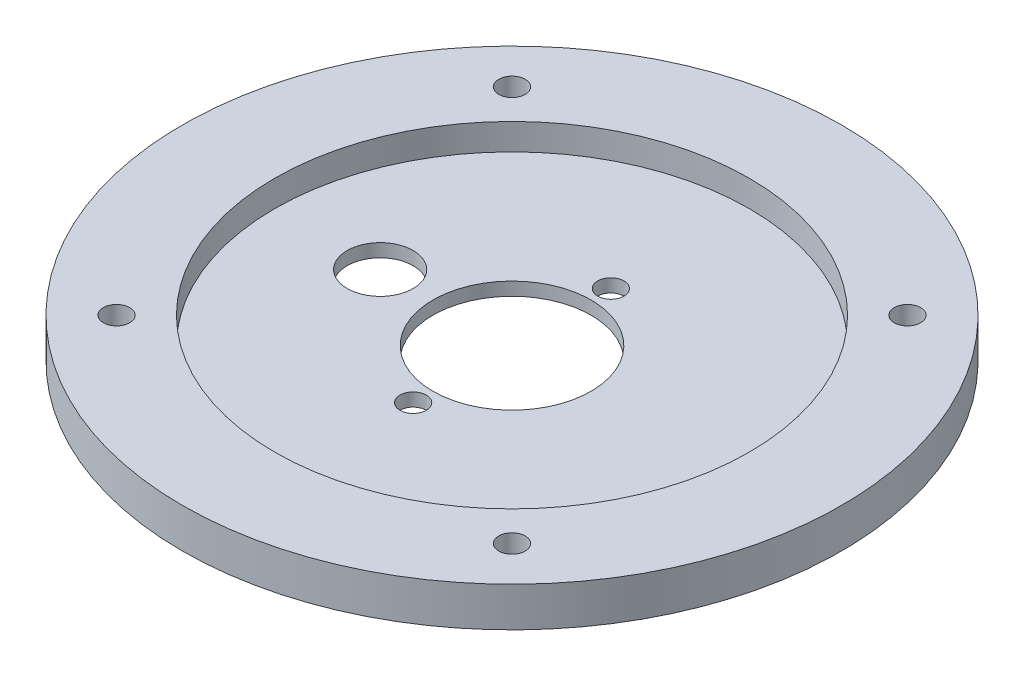
from build123d import *

# Parameters (mm, degrees)
SKETCH1_R           = 25
BOSS_EXTRUDE1_DEPTH = 3
SKETCH3_R           = 6
SKETCH3_R_2         = 1
CUT_EXTRUDE1_DEPTH  = 36.482389998
SKETCH4_R           = 1
CUT_EXTRUDE2_DEPTH  = 36.482389998
CHAMFER1_SIZE       = 1
SKETCH5_R           = 18
CUT_EXTRUDE3_DEPTH  = 2
SKETCH6_R           = 2.5
CUT_EXTRUDE4_DEPTH  = 36.411862419


with BuildPart() as part:
    # Sketch1 → Boss-Extrude1 (new body)
    with BuildSketch(Plane(origin=(0, 0, 0), x_dir=(1, 0, 0), z_dir=(0, 1, 0))):
        Circle(SKETCH1_R)
    extrude(amount=BOSS_EXTRUDE1_DEPTH)

    # Sketch3 → Cut-Extrude1 (cut, through all)
    with BuildSketch(Plane(origin=(0, 3, 0), x_dir=(1, 0, 0), z_dir=(0, 1, 0))):
        Circle(SKETCH3_R)
        with Locations((0, 7.5)):
            Circle(SKETCH3_R_2)
        with Locations((0, -7.5)):
            Circle(SKETCH3_R_2)
    extrude(amount=-CUT_EXTRUDE1_DEPTH, mode=Mode.SUBTRACT)

    # Sketch4 → Cut-Extrude2 (cut, through all)
    with BuildSketch(Plane(origin=(0, 3, 0), x_dir=(1, 0, 0), z_dir=(0, 1, 0))):
        with Locations((-15, 15)):
            Circle(SKETCH4_R)
        with Locations((15, 15)):
            Circle(SKETCH4_R)
        with Locations((15, -15)):
            Circle(SKETCH4_R)
        with Locations((-15, -15)):
            Circle(SKETCH4_R)
    extrude(amount=-CUT_EXTRUDE2_DEPTH, mode=Mode.SUBTRACT)

    # Chamfer1
    chamfer1_edges = [part.edges().sort_by_distance(p)[0] for p in [
        (-16, 0, -15),
        (14, 0, -15),
        (14, 0, 15),
        (-16, 0, 15),
    ]]
    chamfer(chamfer1_edges, length=CHAMFER1_SIZE)

    # Sketch5 → Cut-Extrude3 (cut)
    with BuildSketch(Plane(origin=(0, 3, 0), x_dir=(1, 0, 0), z_dir=(0, 1, 0))):
        Circle(SKETCH5_R)
    extrude(amount=-CUT_EXTRUDE3_DEPTH, mode=Mode.SUBTRACT)

    # Sketch6 → Cut-Extrude4 (cut, through all)
    with BuildSketch(Plane(origin=(0, 1, 0), x_dir=(1, 0, 0), z_dir=(0, 1, 0))):
        with Locations((-10, 0)):
            Circle(SKETCH6_R)
    extrude(amount=-CUT_EXTRUDE4_DEPTH, mode=Mode.SUBTRACT)


solid = part.part
